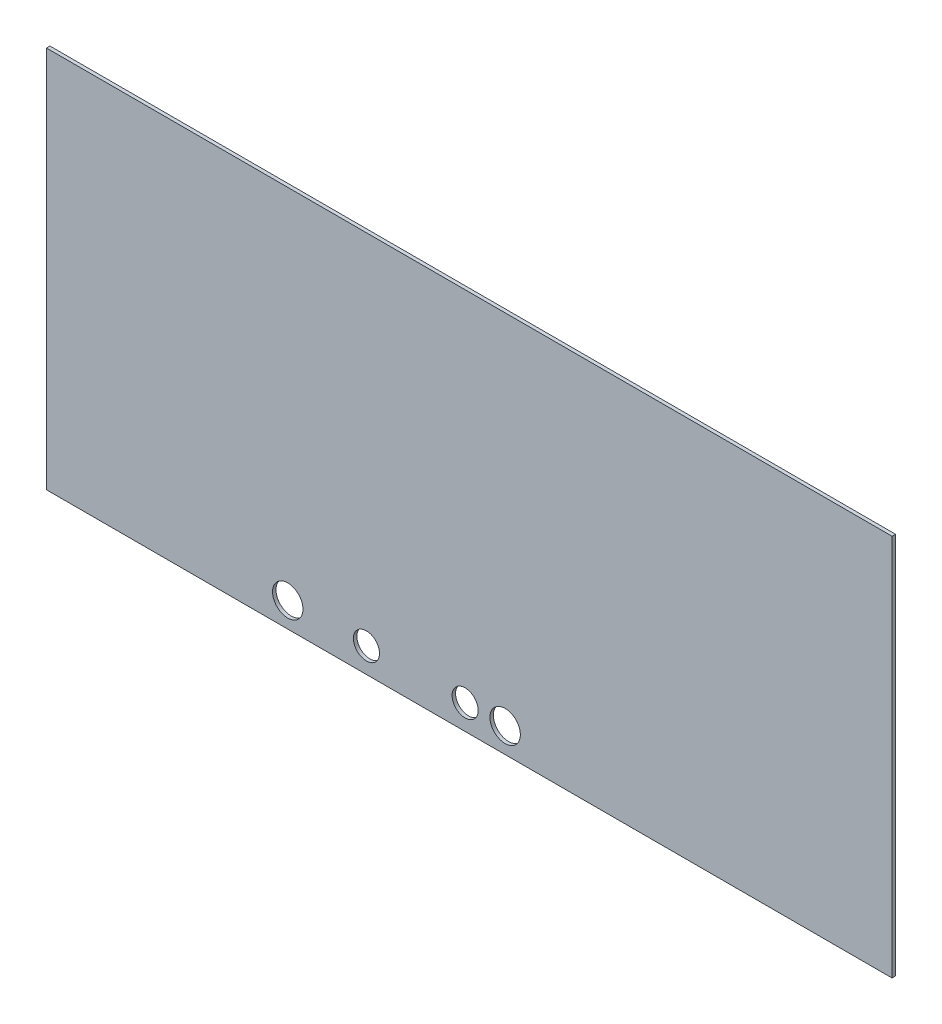
from build123d import *

# Parameters (mm, degrees)
IZIM1_W            = 1945
IZIM1_H            = 880
IZIM1_R            = 35
IZIM1_R_2          = 30
TABAN_FLAN_1_DEPTH = 8


# Sheet-metal steps are written as plain solids
with BuildPart() as part:
    # Çizim1 → Taban-Flanş1 (new body)
    with BuildSketch(Plane.XY):
        with Locations((972.5, -447)):
            Rectangle(IZIM1_W, IZIM1_H)
        with Locations((555, -830)):
            Circle(IZIM1_R, mode=Mode.SUBTRACT)
        with Locations((736, -830)):
            Circle(IZIM1_R_2, mode=Mode.SUBTRACT)
        with Locations((963, -830)):
            Circle(IZIM1_R_2, mode=Mode.SUBTRACT)
        with Locations((1055, -830)):
            Circle(IZIM1_R, mode=Mode.SUBTRACT)
    extrude(amount=-TABAN_FLAN_1_DEPTH)


solid = part.part
